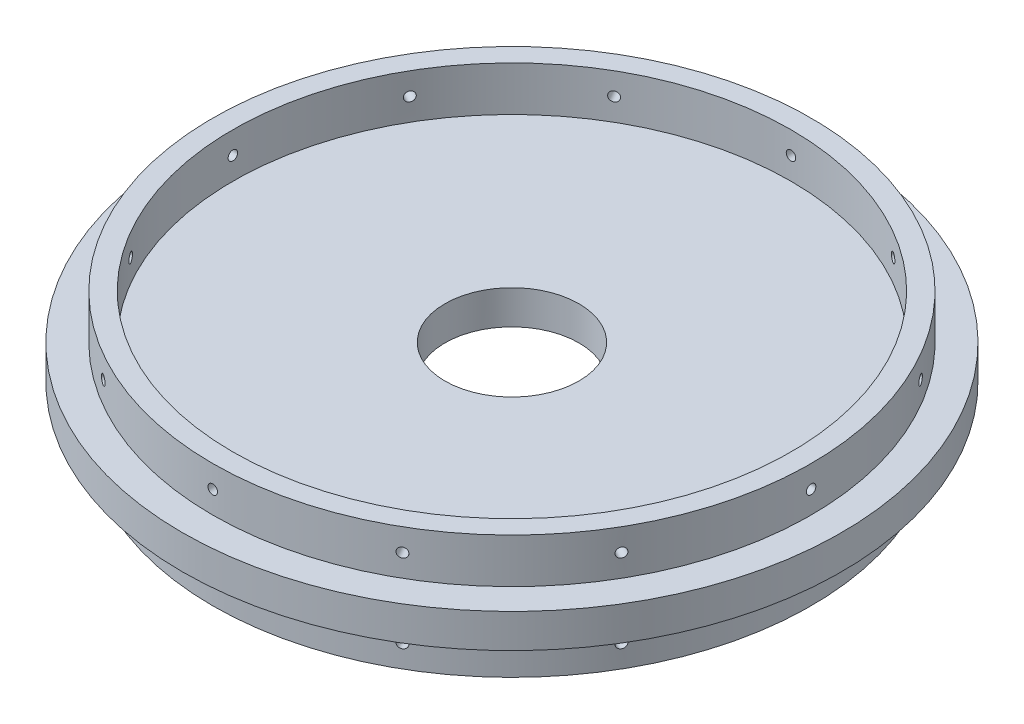
from build123d import *

# Parameters (mm, degrees)
SKETCH1_R                = 93.726
BOSS_EXTRUDE1_DEPTH      = 4.826
SKETCH4_R                = 85.09
SKETCH4_R_2              = 79.375
BOSS_EXTRUDE2_DEPTH      = 12.7
SKETCH5_R                = 1.35255
CUT_EXTRUDE2_DEPTH       = 12.7
CIRPATTERN1_COUNT        = 12
MIRROR2_COPY_1_SKETCH_R  = 1.35255
MIRROR2_COPY_1_DEPTH     = 12.7
MIRROR2_COPY_2_SKETCH_R  = 1.35255
MIRROR2_COPY_2_DEPTH     = 12.7
MIRROR2_COPY_3_SKETCH_R  = 1.35255
MIRROR2_COPY_3_DEPTH     = 12.7
MIRROR2_COPY_4_SKETCH_R  = 1.35255
MIRROR2_COPY_4_DEPTH     = 12.7
MIRROR2_COPY_5_SKETCH_R  = 1.35255
MIRROR2_COPY_5_DEPTH     = 12.7
MIRROR2_COPY_6_SKETCH_R  = 1.35255
MIRROR2_COPY_6_DEPTH     = 12.7
MIRROR2_COPY_7_SKETCH_R  = 1.35255
MIRROR2_COPY_7_DEPTH     = 12.7
MIRROR2_COPY_8_SKETCH_R  = 1.35255
MIRROR2_COPY_8_DEPTH     = 12.7
MIRROR2_COPY_9_SKETCH_R  = 1.35255
MIRROR2_COPY_9_DEPTH     = 12.7
MIRROR2_COPY_10_SKETCH_R = 1.35255
MIRROR2_COPY_10_DEPTH    = 12.7
MIRROR2_COPY_11_SKETCH_R = 1.35255
MIRROR2_COPY_11_DEPTH    = 12.7
SKETCH7_R                = 19.05
CUT_EXTRUDE4_DEPTH       = 135.420006176


with BuildPart() as part:
    # Sketch1 → Boss-Extrude1 (new, symmetric)
    with BuildSketch(Plane(origin=(0, 0, 0), x_dir=(1, 0, 0), z_dir=(0, 1, 0))):
        Circle(SKETCH1_R)
    extrude(amount=BOSS_EXTRUDE1_DEPTH, both=True)

    # Sketch4 → Boss-Extrude2 (add)
    with BuildSketch(Plane(origin=(0, 4.826, 0), x_dir=(1, 0, 0), z_dir=(0, 1, 0))):
        Circle(SKETCH4_R)
        Circle(SKETCH4_R_2, mode=Mode.SUBTRACT)
    boss_extrude2 = extrude(amount=BOSS_EXTRUDE2_DEPTH)

    # Sketch5 → Cut-Extrude2 (cut)
    with BuildSketch(Plane(origin=(0, 0, -85.09), x_dir=(-1, 0, 0), z_dir=(0, 0, -1))):
        with Locations((0, 11.176)):
            Circle(SKETCH5_R)
    cut_extrude2 = extrude(amount=-CUT_EXTRUDE2_DEPTH, mode=Mode.SUBTRACT)

    # CirPattern1: Cut-Extrude2 ×12 about axis
    cirpattern1_axis = Axis((0, 17.526, 0), (0, -1, 0))
    for i in range(1, CIRPATTERN1_COUNT):
        add(cut_extrude2.rotate(cirpattern1_axis, i * 360 / CIRPATTERN1_COUNT), mode=Mode.SUBTRACT)

    # Mirror2: Boss-Extrude2, Cut-Extrude2 across plane
    add(boss_extrude2.mirror(Plane.ZX))
    add(cut_extrude2.mirror(Plane.ZX), mode=Mode.SUBTRACT)

    # Mirror2 copy 1 sketch → Mirror2 copy 1 (cut)
    with BuildSketch(Plane(origin=(42.545, 0, -73.690101608), x_dir=(-0.8660254037844387, 0, -0.49999999999999994), z_dir=(0.49999999999999994, 0, -0.8660254037844387))):
        with Locations((0, -11.176)):
            Circle(MIRROR2_COPY_1_SKETCH_R)
    extrude(amount=-MIRROR2_COPY_1_DEPTH, mode=Mode.SUBTRACT)

    # Mirror2 copy 2 sketch → Mirror2 copy 2 (cut)
    with BuildSketch(Plane(origin=(73.690101608, 0, -42.545), x_dir=(-0.5000000000000001, 0, -0.8660254037844386), z_dir=(0.8660254037844386, 0, -0.5000000000000001))):
        with Locations((0, -11.176)):
            Circle(MIRROR2_COPY_2_SKETCH_R)
    extrude(amount=-MIRROR2_COPY_2_DEPTH, mode=Mode.SUBTRACT)

    # Mirror2 copy 3 sketch → Mirror2 copy 3 (cut)
    with BuildSketch(Plane(origin=(85.09, 0, 0), x_dir=(0, 0, -1), z_dir=(1, 0, 0))):
        with Locations((0, -11.176)):
            Circle(MIRROR2_COPY_3_SKETCH_R)
    extrude(amount=-MIRROR2_COPY_3_DEPTH, mode=Mode.SUBTRACT)

    # Mirror2 copy 4 sketch → Mirror2 copy 4 (cut)
    with BuildSketch(Plane(origin=(73.690101608, 0, 42.545), x_dir=(0.4999999999999998, 0, -0.8660254037844387), z_dir=(0.8660254037844387, 0, 0.4999999999999998))):
        with Locations((0, -11.176)):
            Circle(MIRROR2_COPY_4_SKETCH_R)
    extrude(amount=-MIRROR2_COPY_4_DEPTH, mode=Mode.SUBTRACT)

    # Mirror2 copy 5 sketch → Mirror2 copy 5 (cut)
    with BuildSketch(Plane(origin=(42.545, 0, 73.690101608), x_dir=(0.8660254037844387, 0, -0.49999999999999994), z_dir=(0.49999999999999994, 0, 0.8660254037844387))):
        with Locations((0, -11.176)):
            Circle(MIRROR2_COPY_5_SKETCH_R)
    extrude(amount=-MIRROR2_COPY_5_DEPTH, mode=Mode.SUBTRACT)

    # Mirror2 copy 6 sketch → Mirror2 copy 6 (cut)
    with BuildSketch(Plane.XY.offset(85.09)):
        with Locations((0, -11.176)):
            Circle(MIRROR2_COPY_6_SKETCH_R)
    extrude(amount=-MIRROR2_COPY_6_DEPTH, mode=Mode.SUBTRACT)

    # Mirror2 copy 7 sketch → Mirror2 copy 7 (cut)
    with BuildSketch(Plane(origin=(-42.545, 0, 73.690101608), x_dir=(0.8660254037844386, 0, 0.5000000000000001), z_dir=(-0.5000000000000001, 0, 0.8660254037844386))):
        with Locations((0, -11.176)):
            Circle(MIRROR2_COPY_7_SKETCH_R)
    extrude(amount=-MIRROR2_COPY_7_DEPTH, mode=Mode.SUBTRACT)

    # Mirror2 copy 8 sketch → Mirror2 copy 8 (cut)
    with BuildSketch(Plane(origin=(-73.690101608, 0, 42.545), x_dir=(0.5000000000000004, 0, 0.8660254037844384), z_dir=(-0.8660254037844384, 0, 0.5000000000000004))):
        with Locations((0, -11.176)):
            Circle(MIRROR2_COPY_8_SKETCH_R)
    extrude(amount=-MIRROR2_COPY_8_DEPTH, mode=Mode.SUBTRACT)

    # Mirror2 copy 9 sketch → Mirror2 copy 9 (cut)
    with BuildSketch(Plane.ZY.offset(85.09)):
        with Locations((0, -11.176)):
            Circle(MIRROR2_COPY_9_SKETCH_R)
    extrude(amount=-MIRROR2_COPY_9_DEPTH, mode=Mode.SUBTRACT)

    # Mirror2 copy 10 sketch → Mirror2 copy 10 (cut)
    with BuildSketch(Plane(origin=(-73.690101608, 0, -42.545), x_dir=(-0.5000000000000001, 0, 0.8660254037844386), z_dir=(-0.8660254037844386, 0, -0.5000000000000001))):
        with Locations((0, -11.176)):
            Circle(MIRROR2_COPY_10_SKETCH_R)
    extrude(amount=-MIRROR2_COPY_10_DEPTH, mode=Mode.SUBTRACT)

    # Mirror2 copy 11 sketch → Mirror2 copy 11 (cut)
    with BuildSketch(Plane(origin=(-42.545, 0, -73.690101608), x_dir=(-0.8660254037844384, 0, 0.5000000000000004), z_dir=(-0.5000000000000004, 0, -0.8660254037844384))):
        with Locations((0, -11.176)):
            Circle(MIRROR2_COPY_11_SKETCH_R)
    extrude(amount=-MIRROR2_COPY_11_DEPTH, mode=Mode.SUBTRACT)

    # Sketch7 → Cut-Extrude4 (cut, through all)
    with BuildSketch(Plane.XZ.offset(4.826)):
        Circle(SKETCH7_R)
    extrude(amount=-CUT_EXTRUDE4_DEPTH, mode=Mode.SUBTRACT)


solid = part.part
